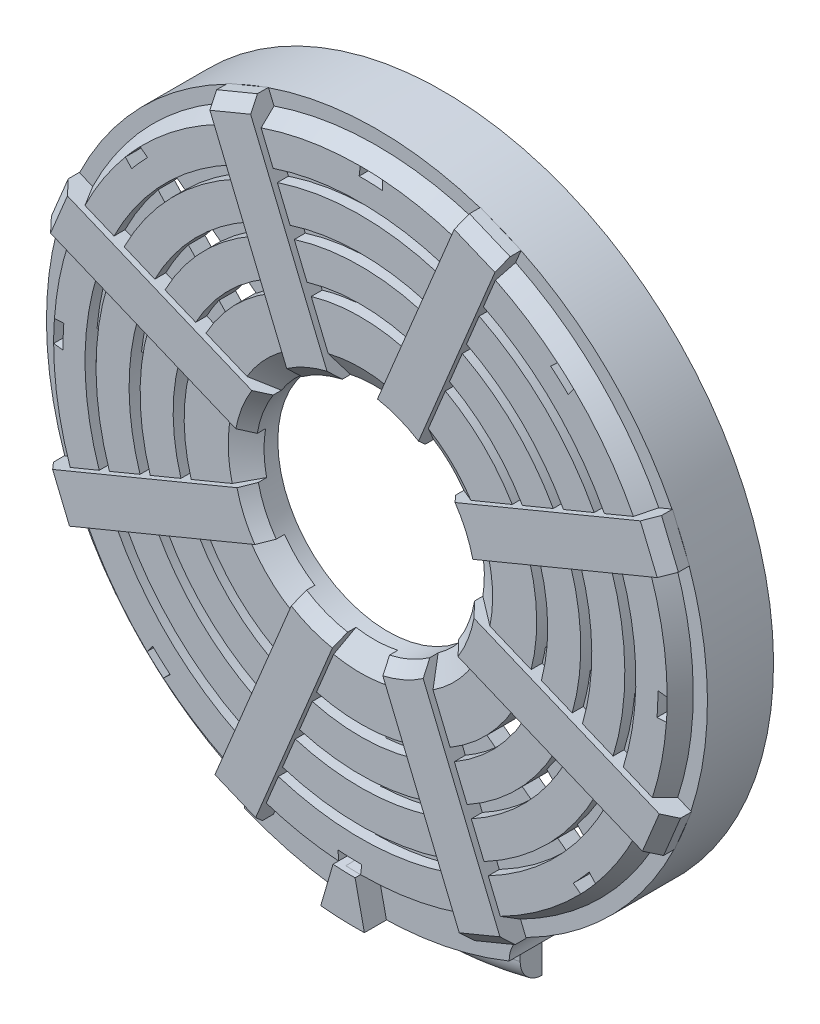
from build123d import *
from build123d.topology import SkipClean

# Parameters (mm, degrees)
SKETCH_2_R           = 26.935647111
EXTRUDE_1_DEPTH      = 2
CUT_EXTRUDE_START    = -2
CUT_EXTRUDE_3_DEPTH  = 2
CUT_EXTRUDE_4_DEPTH  = 2
FILLET_2_R           = 2
EXTRUDE_START        = -2
EXTRUDE_2_DEPTH      = 2
EXTRUDE_3_DEPTH      = 4
SKETCH_9_R           = 30
SKETCH_9_R_2         = 27
EXTRUDE_5_DEPTH      = 4
SKETCH_10_R          = 29
EXTRUDE_6_DEPTH      = 1.5
CHAMFER_1_SIZE       = 2
CHAMFER_1_SIZE_2     = 1.154700538
SKETCH_12_R          = 10
CUT_EXTRUDE_5_DEPTH  = 18
SKETCH_13_R          = 27
EXTRUDE_7_DEPTH      = 6
SKETCH_14_R          = 10
CUT_EXTRUDE_6_DEPTH  = 8
SKETCH_16_R          = 27
CUT_EXTRUDE_7_DEPTH  = 5
CHAMFER_2_SIZE       = 2
CHAMFER_2_SIZE2      = 1.249738704
SKETCH_17_R          = 25
SKETCH_17_R_2        = 24
SKETCH_17_R_3        = 21
SKETCH_17_R_4        = 20
SKETCH_17_R_5        = 17
SKETCH_17_R_6        = 16
CUT_EXTRUDE_10_DEPTH = 1
SKETCH_18_W          = 3
SKETCH_18_H          = 1
CUT_EXTRUDE_11_DEPTH = 71
SKETCH_25_R          = 10.8
SKETCH_25_R_2        = 10.020616019
EXTRUDE_18_DEPTH     = 1
EXTRUDE_19_DEPTH     = 1.5
CHAMFER_3_SIZE       = 2
CHAMFER_4_SIZE       = 2
CUT_EXTRUDE_13_DEPTH = 10
CUT_EXTRUDE_14_DEPTH = 10
EXTRUDE_20_DEPTH     = 3
SKETCH_34_R          = 44.888176971
CUT_EXTRUDE_15_DEPTH = 1


# Some blends are built 0.0001 mm under size
with BuildPart() as part:
    # 草图2 → 凸台-拉伸1 (new body)
    with BuildSketch(Plane.XY.offset(20)):
        with BuildLine():
            Line((12, -35.49545417), (12, -29.393876913))
            ThreePointArc((12, -29.393876913), (12.441591404, -27.82717801), (13.636363636, -26.721706285))
            ThreePointArc((13.636363636, -26.721706285), (0, 30), (-13.636363636, -26.721706285))
            ThreePointArc((-13.636363636, -26.721706285), (-12.441591404, -27.82717801), (-12, -29.393876913))
            Line((-12, -29.393876913), (-12, -35.49545417))
            ThreePointArc((-12, -35.49545417), (0, -37.469017424), (12, -35.49545417))
        make_face()
        Circle(SKETCH_2_R, mode=Mode.SUBTRACT)
    extrude(amount=EXTRUDE_1_DEPTH)

    # 草图3 → 切除-拉伸3 (cut)
    with BuildSketch(Plane.XY.offset(22).offset(CUT_EXTRUDE_START)):
        with BuildLine():
            Line((-9, -36.372067122), (-9, -28.618176043))
            ThreePointArc((-9, -28.618176043), (-11.357833819, -27.766879748), (-13.636363636, -26.721706285))
            ThreePointArc((-13.636363636, -26.721706285), (-12.441591404, -27.82717801), (-12, -29.393876913))
            Line((-12, -29.393876913), (-12, -35.49545417))
            ThreePointArc((-12, -35.49545417), (-10.509144236, -35.965054625), (-9, -36.372067122))
        make_face()
        with BuildLine():
            Line((9, -36.372067122), (9, -28.618176043))
            ThreePointArc((9, -28.618176043), (11.357833819, -27.766879748), (13.636363636, -26.721706285))
            ThreePointArc((13.636363636, -26.721706285), (12.441591404, -27.82717801), (12, -29.393876913))
            Line((12, -29.393876913), (12, -35.49545417))
            ThreePointArc((12, -35.49545417), (10.509144236, -35.965054625), (9, -36.372067122))
        make_face()
    extrude(amount=CUT_EXTRUDE_3_DEPTH, mode=Mode.SUBTRACT)

    # 草图4 → 切除-拉伸4 (cut)
    with BuildSketch(Plane.XY.offset(22).offset(CUT_EXTRUDE_START)):
        with BuildLine():
            Line((9, -35), (9, -36.372067122))
            ThreePointArc((9, -36.372067122), (0, -37.469017424), (-9, -36.372067122))
            Line((-9, -36.372067122), (-9, -35))
            ThreePointArc((-9, -35), (0, -36.138621999), (9, -35))
        make_face()
    extrude(amount=CUT_EXTRUDE_4_DEPTH, mode=Mode.SUBTRACT)

    # 圆角2
    fillet_2_edges = [part.edges().sort_by_distance(p)[0] for p in [
        (0, -36.138621999, 22),
    ]]
    fillet(fillet_2_edges, radius=FILLET_2_R - 0.0001)  # a hair under: the kernel refuses the full size

    # 草图7 → 凸台-拉伸2 (add)
    with BuildSketch(Plane.XY.offset(22).offset(EXTRUDE_START)):
        with BuildLine():
            Line((-9, -30.446674695), (-9, -28.618176043))
            ThreePointArc((-9, -28.618176043), (-11.357833819, -27.766879748), (-13.636363636, -26.721706285))
            ThreePointArc((-13.636363636, -26.721706285), (-12.441591404, -27.82717801), (-12, -29.393876913))
            ThreePointArc((-12, -29.393876913), (-10.513186757, -29.957852129), (-9, -30.446674695))
        make_face()
        with BuildLine():
            ThreePointArc((9, -28.618176043), (0, -30), (-9, -28.618176043))
            Line((-9, -28.618176043), (-9, -30.446674695))
            ThreePointArc((-9, -30.446674695), (0, -31.749015733), (9, -30.446674695))
            Line((9, -30.446674695), (9, -28.618176043))
        make_face()
        with BuildLine():
            ThreePointArc((13.636363636, -26.721706285), (11.357833819, -27.766879748), (9, -28.618176043))
            Line((9, -28.618176043), (9, -30.446674695))
            ThreePointArc((9, -30.446674695), (10.513186757, -29.957852129), (12, -29.393876913))
            ThreePointArc((12, -29.393876913), (12.441591404, -27.82717801), (13.636363636, -26.721706285))
        make_face()
    extrude(amount=EXTRUDE_2_DEPTH)

    # 草图8 → 凸台-拉伸3 (add)
    with BuildSketch(Plane.XY.offset(22)):
        with BuildLine():
            ThreePointArc((-12, -29.393876913), (0, -31.749015733), (12, -29.393876913))
            ThreePointArc((12, -29.393876913), (12.441591404, -27.82717801), (13.636363636, -26.721706285))
            ThreePointArc((13.636363636, -26.721706285), (0, -30), (-13.636363636, -26.721706285))
            ThreePointArc((-13.636363636, -26.721706285), (-12.441591404, -27.82717801), (-12, -29.393876913))
        make_face()
    extrude(amount=EXTRUDE_3_DEPTH)

    # 草图9 → 凸台-拉伸5 (add)
    with BuildSketch(Plane.XY.offset(22)):
        Circle(SKETCH_9_R)
        Circle(SKETCH_9_R_2, mode=Mode.SUBTRACT)
    extrude(amount=EXTRUDE_5_DEPTH)

    # 草图10 → 凸台-拉伸6 (add)
    with BuildSketch(Plane.XY.offset(26)):
        with Locations(Location((0, 0, 0), (0, 0, 180))):
            Circle(SKETCH_10_R)
    extrude(amount=EXTRUDE_6_DEPTH)

    # 倒角1
    # the kernel refuses this chamfer: 2, 1.154700538 mm, written as the material it takes off along each edge
    with BuildSketch(Plane(origin=(0, 0, 27.5), x_dir=(-1, 0, 0), z_dir=(0, 1, 0))) as chamfer_1_piece_1_section:
        Polygon((29, -CHAMFER_1_SIZE), (29 - CHAMFER_1_SIZE_2, 0), (29, 0), align=None)
    chamfer_1_piece_1 = revolve(axis=Axis((0, 0, 27.5), (0, 0, 1)), mode=Mode.PRIVATE)
    chamfer_1_piece_1 = split(chamfer_1_piece_1, bisect_by=Plane(origin=(28.310285577, 0, 26), z_dir=(0, 0, 1)), keep=Keep.TOP, mode=Mode.PRIVATE)
    add(chamfer_1_piece_1, mode=Mode.SUBTRACT)

    # 草图12 → 切除-拉伸5 (cut)
    with BuildSketch(Plane.XY.offset(27.5)):
        Circle(SKETCH_12_R)
    extrude(amount=-CUT_EXTRUDE_5_DEPTH, mode=Mode.SUBTRACT)

    # 草图13 → 凸台-拉伸7 (add)
    with BuildSketch(Plane(origin=(0, 0, 20), x_dir=(-1, 0, 0), z_dir=(0, 0, -1))):
        Circle(SKETCH_13_R)
    extrude(amount=-EXTRUDE_7_DEPTH)

    # 草图14 → 切除-拉伸6 (cut)
    with BuildSketch(Plane.XY.offset(27.5)):
        Circle(SKETCH_14_R)
    extrude(amount=-CUT_EXTRUDE_6_DEPTH, mode=Mode.SUBTRACT)

    # 草图16 → 切除-拉伸7 (cut)
    with BuildSketch(Plane(origin=(0, 0, 20), x_dir=(-1, 0, 0), z_dir=(0, 0, -1))):
        Circle(SKETCH_16_R)
    extrude(amount=-CUT_EXTRUDE_7_DEPTH, mode=Mode.SUBTRACT)

    # 倒角2
    chamfer_2_edges = [part.edges().sort_by_distance(p)[0] for p in [
        (-10, 0, 27.5),
    ]]
    chamfer_2_side = [part.faces().sort_by_distance(p)[0] for p in [
        (27.057715459, 0, 27.5),
    ]]
    chamfer(chamfer_2_edges, length=CHAMFER_2_SIZE, length2=CHAMFER_2_SIZE2, reference=chamfer_2_side[0])

    # 草图17 → 切除-拉伸10 (cut)
    # profile 1 of 3: a face of its own
    with BuildSketch(Plane.XY.offset(27.5)):
        Circle(SKETCH_17_R)
        Circle(SKETCH_17_R_2, mode=Mode.SUBTRACT)
    # profile 2 of 3: a face of its own
    with BuildSketch(Plane.XY.offset(27.5)):
        Circle(SKETCH_17_R_3)
        Circle(SKETCH_17_R_4, mode=Mode.SUBTRACT)
    # profile 3 of 3: a face of its own
    with BuildSketch(Plane.XY.offset(27.5)):
        Circle(SKETCH_17_R_5)
        Circle(SKETCH_17_R_6, mode=Mode.SUBTRACT)
    extrude(amount=-CUT_EXTRUDE_10_DEPTH, mode=Mode.SUBTRACT)

    # 草图18 → 切除-拉伸11 (cut)
    with BuildSketch(Plane(origin=(0, 0, 0), x_dir=(1, 0, 0), z_dir=(0, 1, 0))):
        with Locations((-9, -23.265514754)):
            Rectangle(SKETCH_18_W, SKETCH_18_H)
        with Locations((-3, -23.265514754)):
            Rectangle(SKETCH_18_W, SKETCH_18_H)
        with Locations((9, -23.265514754)):
            Rectangle(SKETCH_18_W, SKETCH_18_H)
        with Locations((3, -23.265514754)):
            Rectangle(SKETCH_18_W, SKETCH_18_H)
    extrude(amount=-CUT_EXTRUDE_11_DEPTH, mode=Mode.SUBTRACT)

    # 草图25 → 凸台-拉伸18 (add)
    with BuildSketch(Plane(origin=(0, 0, 25), x_dir=(-1, 0, 0), z_dir=(0, 0, -1))):
        Circle(SKETCH_25_R)
        Circle(SKETCH_25_R_2, mode=Mode.SUBTRACT)
    extrude(amount=-EXTRUDE_18_DEPTH)

    # 草图26 → 凸台-拉伸19 (add, symmetric)
    with SkipClean():  # the faces are left unmerged after this step: merging them gives an invalid solid
        with BuildSketch(Plane.XY.offset(27.5)):
            with BuildLine():
                ThreePointArc((-12.696537001, 24.782224482), (-10.883678655, 25.630182228), (-9.014595586, 26.345735301))
                Line((-9.014595586, 26.345735301), (-9.849943097, 28.362442592))
                Line((-9.849943097, 28.362442592), (-13.545461227, 26.831708862))
                Line((-13.545461227, 26.831708862), (-12.696537001, 24.782224482))
            make_face()
            with BuildLine():
                ThreePointArc((-5.804366846, 8.14305382), (-4.057894195, 9.139666006), (-2.147344545, 9.766724702))
                Line((-2.147344545, 9.766724702), (-7.923333429, 23.711195402))
                ThreePointArc((-7.923333429, 23.711195402), (-9.794923887, 23.001292704), (-11.603720064, 22.143931012))
                Line((-11.603720064, 22.143931012), (-5.804366846, 8.14305382))
            make_face()
            with BuildLine():
                ThreePointArc((-11.603720064, 22.143931012), (-9.794923887, 23.001292704), (-7.923333429, 23.711195402))
                Line((-7.923333429, 23.711195402), (-9.014595586, 26.345735301))
                ThreePointArc((-9.014595586, 26.345735301), (-10.883678655, 25.630182228), (-12.696537001, 24.782224482))
                Line((-12.696537001, 24.782224482), (-11.603720064, 22.143931012))
            make_face()
            with BuildLine():
                ThreePointArc((8.545871573, 26.501486395), (10.427352675, 25.819198638), (12.254966418, 25.003529755))
                Line((12.254966418, 25.003529755), (13.090313929, 27.020237046))
                Line((13.090313929, 27.020237046), (9.394795799, 28.550970775))
                Line((9.394795799, 28.550970775), (8.545871573, 26.501486395))
            make_face()
            with BuildLine():
                ThreePointArc((7.453054636, 23.863192925), (9.338312945, 23.190427149), (11.163704261, 22.368989856))
                Line((11.163704261, 22.368989856), (12.254966418, 25.003529755))
                ThreePointArc((12.254966418, 25.003529755), (10.427352675, 25.819198638), (8.545871573, 26.501486395))
                Line((8.545871573, 26.501486395), (7.453054636, 23.863192925))
            make_face()
            with BuildLine():
                ThreePointArc((1.653701418, 9.862315733), (3.593355308, 9.332084313), (5.387715377, 8.424519156))
                Line((5.387715377, 8.424519156), (11.163704261, 22.368989856))
                ThreePointArc((11.163704261, 22.368989856), (9.338312945, 23.190427149), (7.453054636, 23.863192925))
                Line((7.453054636, 23.863192925), (1.653701418, 9.862315733))
            make_face()
            with BuildLine():
                Line((22.143931012, 11.603720064), (8.14305382, 5.804366846))
                ThreePointArc((8.14305382, 5.804366846), (9.139666006, 4.057894195), (9.766724702, 2.147344545))
                Line((9.766724702, 2.147344545), (23.711195402, 7.923333429))
                ThreePointArc((23.711195402, 7.923333429), (23.001292704, 9.794923887), (22.143931012, 11.603720064))
            make_face()
            with BuildLine():
                Line((24.782224482, 12.696537001), (22.143931012, 11.603720064))
                ThreePointArc((22.143931012, 11.603720064), (23.001292704, 9.794923887), (23.711195402, 7.923333429))
                Line((23.711195402, 7.923333429), (26.345735301, 9.014595586))
                ThreePointArc((26.345735301, 9.014595586), (25.630182228, 10.883678655), (24.782224482, 12.696537001))
            make_face()
            with BuildLine():
                Line((26.831708862, 13.545461227), (24.782224482, 12.696537001))
                ThreePointArc((24.782224482, 12.696537001), (25.630182228, 10.883678655), (26.345735301, 9.014595586))
                Line((26.345735301, 9.014595586), (28.362442592, 9.849943097))
                Line((28.362442592, 9.849943097), (26.831708862, 13.545461227))
            make_face()
            with BuildLine():
                Line((26.501486395, -8.545871573), (23.863192925, -7.453054636))
                ThreePointArc((23.863192925, -7.453054636), (23.190427149, -9.338312945), (22.368989856, -11.163704261))
                Line((22.368989856, -11.163704261), (25.003529755, -12.254966418))
                ThreePointArc((25.003529755, -12.254966418), (25.819198638, -10.427352675), (26.501486395, -8.545871573))
            make_face()
            with BuildLine():
                Line((28.550970775, -9.394795799), (26.501486395, -8.545871573))
                ThreePointArc((26.501486395, -8.545871573), (25.819198638, -10.427352675), (25.003529755, -12.254966418))
                Line((25.003529755, -12.254966418), (27.020237046, -13.090313929))
                Line((27.020237046, -13.090313929), (28.550970775, -9.394795799))
            make_face()
            with BuildLine():
                Line((23.863192925, -7.453054636), (9.862315733, -1.653701418))
                ThreePointArc((9.862315733, -1.653701418), (9.332084313, -3.593355308), (8.424519156, -5.387715377))
                Line((8.424519156, -5.387715377), (22.368989856, -11.163704261))
                ThreePointArc((22.368989856, -11.163704261), (23.190427149, -9.338312945), (23.863192925, -7.453054636))
            make_face()
            with BuildLine():
                Line((11.603720064, -22.143931012), (5.804366846, -8.14305382))
                ThreePointArc((5.804366846, -8.14305382), (4.057894195, -9.139666006), (2.147344545, -9.766724702))
                Line((2.147344545, -9.766724702), (7.923333429, -23.711195402))
                ThreePointArc((7.923333429, -23.711195402), (9.794923887, -23.001292704), (11.603720064, -22.143931012))
            make_face()
            with BuildLine():
                Line((12.696537001, -24.782224482), (11.603720064, -22.143931012))
                ThreePointArc((11.603720064, -22.143931012), (9.794923887, -23.001292704), (7.923333429, -23.711195402))
                Line((7.923333429, -23.711195402), (9.014595586, -26.345735301))
                ThreePointArc((9.014595586, -26.345735301), (10.883678655, -25.630182228), (12.696537001, -24.782224482))
            make_face()
            with BuildLine():
                Line((13.545461227, -26.831708862), (12.696537001, -24.782224482))
                ThreePointArc((12.696537001, -24.782224482), (10.883678655, -25.630182228), (9.014595586, -26.345735301))
                Line((9.014595586, -26.345735301), (9.849943097, -28.362442592))
                Line((9.849943097, -28.362442592), (13.545461227, -26.831708862))
            make_face()
            with BuildLine():
                Line((-9.394795799, -28.550970775), (-8.545871573, -26.501486395))
                ThreePointArc((-8.545871573, -26.501486395), (-10.427352675, -25.819198638), (-12.254966418, -25.003529755))
                Line((-12.254966418, -25.003529755), (-13.090313929, -27.020237046))
                Line((-13.090313929, -27.020237046), (-9.394795799, -28.550970775))
            make_face()
            with BuildLine():
                Line((-7.453054636, -23.863192925), (-1.653701418, -9.862315733))
                ThreePointArc((-1.653701418, -9.862315733), (-3.593355308, -9.332084313), (-5.387715377, -8.424519156))
                Line((-5.387715377, -8.424519156), (-11.163704261, -22.368989856))
                ThreePointArc((-11.163704261, -22.368989856), (-9.338312945, -23.190427149), (-7.453054636, -23.863192925))
            make_face()
            with BuildLine():
                Line((-8.545871573, -26.501486395), (-7.453054636, -23.863192925))
                ThreePointArc((-7.453054636, -23.863192925), (-9.338312945, -23.190427149), (-11.163704261, -22.368989856))
                Line((-11.163704261, -22.368989856), (-12.254966418, -25.003529755))
                ThreePointArc((-12.254966418, -25.003529755), (-10.427352675, -25.819198638), (-8.545871573, -26.501486395))
            make_face()
            with BuildLine():
                ThreePointArc((-8.14305382, -5.804366846), (-9.139666006, -4.057894195), (-9.766724702, -2.147344545))
                Line((-9.766724702, -2.147344545), (-23.711195402, -7.923333429))
                ThreePointArc((-23.711195402, -7.923333429), (-23.001292704, -9.794923887), (-22.143931012, -11.603720064))
                Line((-22.143931012, -11.603720064), (-8.14305382, -5.804366846))
            make_face()
            with BuildLine():
                ThreePointArc((-22.143931012, -11.603720064), (-23.001292704, -9.794923887), (-23.711195402, -7.923333429))
                Line((-23.711195402, -7.923333429), (-26.345735301, -9.014595586))
                ThreePointArc((-26.345735301, -9.014595586), (-25.630182228, -10.883678655), (-24.782224482, -12.696537001))
                Line((-24.782224482, -12.696537001), (-22.143931012, -11.603720064))
            make_face()
            with BuildLine():
                ThreePointArc((-24.782224482, -12.696537001), (-25.630182228, -10.883678655), (-26.345735301, -9.014595586))
                Line((-26.345735301, -9.014595586), (-28.362442592, -9.849943097))
                Line((-28.362442592, -9.849943097), (-26.831708862, -13.545461227))
                Line((-26.831708862, -13.545461227), (-24.782224482, -12.696537001))
            make_face()
            with BuildLine():
                ThreePointArc((-9.862315733, 1.653701418), (-9.332084313, 3.593355308), (-8.424519156, 5.387715377))
                Line((-8.424519156, 5.387715377), (-22.368989856, 11.163704261))
                ThreePointArc((-22.368989856, 11.163704261), (-23.190427149, 9.338312945), (-23.863192925, 7.453054636))
                Line((-23.863192925, 7.453054636), (-9.862315733, 1.653701418))
            make_face()
            with BuildLine():
                ThreePointArc((-23.863192925, 7.453054636), (-23.190427149, 9.338312945), (-22.368989856, 11.163704261))
                Line((-22.368989856, 11.163704261), (-25.003529755, 12.254966418))
                ThreePointArc((-25.003529755, 12.254966418), (-25.819198638, 10.427352675), (-26.501486395, 8.545871573))
                Line((-26.501486395, 8.545871573), (-23.863192925, 7.453054636))
            make_face()
            with BuildLine():
                ThreePointArc((-26.501486395, 8.545871573), (-25.819198638, 10.427352675), (-25.003529755, 12.254966418))
                Line((-25.003529755, 12.254966418), (-27.020237046, 13.090313929))
                Line((-27.020237046, 13.090313929), (-28.550970775, 9.394795799))
                Line((-28.550970775, 9.394795799), (-26.501486395, 8.545871573))
            make_face()
        extrude(amount=EXTRUDE_19_DEPTH, both=True)

    # 倒角3
    chamfer_3_edges = [part.edges().sort_by_distance(p)[0] for p in [
        (-4.057894195, 9.139666006, 29),
        (3.593355308, 9.332084313, 29),
        (9.139666006, 4.057894195, 29),
        (9.332084313, -3.593355308, 29),
        (4.057894195, -9.139666006, 29),
        (-3.593355308, -9.332084313, 29),
        (-9.139666006, -4.057894195, 29),
        (-9.332084313, 3.593355308, 29),
    ]]
    chamfer(chamfer_3_edges, length=CHAMFER_3_SIZE)

    # 倒角4
    chamfer_4_edges = [part.edges().sort_by_distance(p)[0] for p in [
        (-11.697702162, 27.597075727, 29),
        (11.242554864, 27.785603911, 29),
        (27.597075727, 11.697702162, 29),
        (27.785603911, -11.242554864, 29),
        (11.697702162, -27.597075727, 29),
        (-11.242554864, -27.785603911, 29),
        (-27.597075727, -11.697702162, 29),
        (-27.785603911, 11.242554864, 29),
    ]]
    chamfer(chamfer_4_edges, length=CHAMFER_4_SIZE)

    # 草图30 → 切除-拉伸13 (cut)
    with BuildSketch(Plane.XY.offset(27.5)):
        with BuildLine():
            Line((-2.126135419, -24.909426894), (-2.175382477, -23.901207314))
            ThreePointArc((-2.175382477, -23.901207314), (-0.849786937, -23.984950743), (0.478411395, -23.995231246))
            Line((0.478411395, -23.995231246), (0.357934938, -24.99743752))
            ThreePointArc((0.357934938, -24.99743752), (-0.885194726, -24.984323691), (-2.126135419, -24.909426894))
        make_face()
        with BuildLine():
            Line((-12.843867709, -16.614302943), (-12.104365365, -15.92119151))
            ThreePointArc((-12.104365365, -15.92119151), (-13.390169765, -14.856088101), (-14.582653444, -13.68744748))
            Line((-14.582653444, -13.68744748), (-15.195490387, -14.494725658))
            ThreePointArc((-15.195490387, -14.494725658), (-14.059678253, -15.598892506), (-12.843867709, -16.614302943))
        make_face()
        with BuildLine():
            Line((2.126135419, 24.909426894), (2.175382477, 23.901207314))
            ThreePointArc((2.175382477, 23.901207314), (0.849786937, 23.984950743), (-0.478411395, 23.995231246))
            Line((-0.478411395, 23.995231246), (-0.357934938, 24.99743752))
            ThreePointArc((-0.357934938, 24.99743752), (0.885194726, 24.984323691), (2.126135419, 24.909426894))
        make_face()
        with BuildLine():
            Line((-2.56527052, -15.919151584), (-2.571480969, -15.792007017))
            ThreePointArc((-2.571480969, -15.792007017), (-0.566524625, -15.989967162), (1.447414317, -15.934396499))
            Line((1.447414317, -15.934396499), (1.432221271, -16.06078274))
            Line((1.432221271, -16.06078274), (1.32553855, -16.9482432))
            ThreePointArc((1.32553855, -16.9482432), (-0.601932414, -16.98934011), (-2.521661916, -16.811936866))
            Line((-2.521661916, -16.811936866), (-2.56527052, -15.919151584))
        make_face()
        with BuildLine():
            Line((-1.986195559, -27.774371808), (-2.027744721, -26.923748835))
            ThreePointArc((-2.027744721, -26.923748835), (-0.956010304, -26.983069586), (0.11723502, -26.999745479))
            Line((0.11723502, -26.999745479), (0.015590454, -27.845295097))
            ThreePointArc((0.015590454, -27.845295097), (-0.985940489, -27.827839001), (-1.986195559, -27.774371808))
        make_face()
        with BuildLine():
            Line((-12.738209811, -11.257797779), (-12.197744622, -10.545853504))
            Line((-12.197744622, -10.545853504), (-12.120775149, -10.444463116))
            ThreePointArc((-12.120775149, -10.444463116), (-10.712135812, -11.884870481), (-9.133648943, -13.136835882))
            Line((-9.133648943, -13.136835882), (-9.226527002, -13.223887457))
            Line((-9.226527002, -13.223887457), (-9.878699294, -13.83514728))
            ThreePointArc((-9.878699294, -13.83514728), (-11.3816443, -12.627674886), (-12.738209811, -11.257797779))
        make_face()
        with BuildLine():
            Line((0.840494588, -20.983173469), (0.961462809, -19.976876364))
            ThreePointArc((0.961462809, -19.976876364), (-0.708155781, -19.987458953), (-2.372838988, -19.858742033))
            Line((-2.372838988, -19.858742033), (-2.323390913, -20.871076989))
            ThreePointArc((-2.323390913, -20.871076989), (-0.74356357, -20.9868319), (0.840494588, -20.983173469))
        make_face()
        with BuildLine():
            Line((-19.374536136, -19.999701289), (-18.859594733, -19.321379001))
            ThreePointArc((-18.859594733, -19.321379001), (-18.076729183, -20.055718937), (-17.265294623, -20.758362208))
            Line((-17.265294623, -20.758362208), (-17.886667696, -21.340754927))
            ThreePointArc((-17.886667696, -21.340754927), (-18.642664347, -20.6836111), (-19.374536136, -19.999701289))
        make_face()
        with BuildLine():
            Line((-17.640185195, -17.715074549), (-17.029839576, -16.911078144))
            ThreePointArc((-17.029839576, -16.911078144), (-16.068203718, -17.827305721), (-15.057352946, -18.688930474))
            Line((-15.057352946, -18.688930474), (-15.793849042, -19.379224248))
            ThreePointArc((-15.793849042, -19.379224248), (-16.737712206, -18.570110126), (-17.640185195, -17.715074549))
        make_face()
        with BuildLine():
            Line((2.56527052, 15.919151584), (2.571480969, 15.792007017))
            ThreePointArc((2.571480969, 15.792007017), (0.566524625, 15.989967162), (-1.447414317, 15.934396499))
            Line((-1.447414317, 15.934396499), (-1.432221271, 16.06078274))
            Line((-1.432221271, 16.06078274), (-1.32553855, 16.9482432))
            ThreePointArc((-1.32553855, 16.9482432), (0.601932414, 16.98934011), (2.521661916, 16.811936866))
            Line((2.521661916, 16.811936866), (2.56527052, 15.919151584))
        make_face()
        with BuildLine():
            Line((1.986195559, 27.774371808), (2.027744721, 26.923748835))
            ThreePointArc((2.027744721, 26.923748835), (0.956010304, 26.983069586), (-0.11723502, 26.999745479))
            Line((-0.11723502, 26.999745479), (-0.015590454, 27.845295097))
            ThreePointArc((-0.015590454, 27.845295097), (0.985940489, 27.827839001), (1.986195559, 27.774371808))
        make_face()
        with BuildLine():
            Line((12.843867709, 16.614302943), (12.104365365, 15.92119151))
            ThreePointArc((12.104365365, 15.92119151), (13.390169765, 14.856088101), (14.582653444, 13.68744748))
            Line((14.582653444, 13.68744748), (15.195490387, 14.494725658))
            ThreePointArc((15.195490387, 14.494725658), (14.059678253, 15.598892506), (12.843867709, 16.614302943))
        make_face()
        with BuildLine():
            Line((12.738209811, 11.257797779), (12.197744622, 10.545853504))
            Line((12.197744622, 10.545853504), (12.120775149, 10.444463116))
            ThreePointArc((12.120775149, 10.444463116), (10.712135812, 11.884870481), (9.133648943, 13.136835882))
            Line((9.133648943, 13.136835882), (9.226527002, 13.223887457))
            Line((9.226527002, 13.223887457), (9.878699294, 13.83514728))
            ThreePointArc((9.878699294, 13.83514728), (11.3816443, 12.627674886), (12.738209811, 11.257797779))
        make_face()
        with BuildLine():
            Line((19.374536136, 19.999701289), (18.859594733, 19.321379001))
            ThreePointArc((18.859594733, 19.321379001), (18.076729183, 20.055718937), (17.265294623, 20.758362208))
            Line((17.265294623, 20.758362208), (17.886667696, 21.340754927))
            ThreePointArc((17.886667696, 21.340754927), (18.642664347, 20.6836111), (19.374536136, 19.999701289))
        make_face()
        with BuildLine():
            Line((-0.840494588, 20.983173469), (-0.961462809, 19.976876364))
            ThreePointArc((-0.961462809, 19.976876364), (0.708155781, 19.987458953), (2.372838988, 19.858742033))
            Line((2.372838988, 19.858742033), (2.323390913, 20.871076989))
            ThreePointArc((2.323390913, 20.871076989), (0.74356357, 20.9868319), (-0.840494588, 20.983173469))
        make_face()
        with BuildLine():
            Line((17.640185195, 17.715074549), (17.029839576, 16.911078144))
            ThreePointArc((17.029839576, 16.911078144), (16.068203718, 17.827305721), (15.057352946, 18.688930474))
            Line((15.057352946, 18.688930474), (15.793849042, 19.379224248))
            ThreePointArc((15.793849042, 19.379224248), (16.737712206, 18.570110126), (17.640185195, 17.715074549))
        make_face()
    extrude(amount=-CUT_EXTRUDE_13_DEPTH, mode=Mode.SUBTRACT)

    # 草图31 → 切除-拉伸14 (cut)
    with BuildSketch(Plane.XY.offset(27.5)):
        with BuildLine():
            Line((19.32146818, -18.85950337), (19.999703135, -19.37453423))
            ThreePointArc((19.999703135, -19.37453423), (20.6836111, -18.642664347), (21.340753222, -17.886669729))
            Line((21.340753222, -17.886669729), (20.758280568, -17.265392781))
            ThreePointArc((20.758280568, -17.265392781), (20.055718937, -18.076729183), (19.32146818, -18.85950337))
        make_face()
        with BuildLine():
            Line((15.898543824, -2.564540387), (16.812179047, -2.520046764))
            ThreePointArc((16.812179047, -2.520046764), (16.98934011, -0.601932414), (16.948370467, 1.323910308))
            Line((16.948370467, 1.323910308), (16.04017498, 1.432951404))
            Line((16.04017498, 1.432951404), (15.934558287, 1.445632109))
            ThreePointArc((15.934558287, 1.445632109), (15.989967162, -0.566524625), (15.792294528, -2.56971468))
            Line((15.792294528, -2.56971468), (15.898543824, -2.564540387))
        make_face()
        with BuildLine():
            Line((19.858881229, -2.371673742), (20.871190083, -2.322374758))
            ThreePointArc((20.871190083, -2.322374758), (20.9868319, -0.74356357), (20.983214366, 0.839472977))
            Line((20.983214366, 0.839472977), (19.976932745, 0.960290633))
            ThreePointArc((19.976932745, 0.960290633), (19.987458953, -0.708155781), (19.858881229, -2.371673742))
        make_face()
        with BuildLine():
            Line((23.995242663, 0.477838429), (24.997443591, 0.357510715))
            ThreePointArc((24.997443591, 0.357510715), (24.984323691, -0.885194726), (24.909462972, -2.12571269))
            Line((24.909462972, -2.12571269), (23.901259252, -2.174811756))
            ThreePointArc((23.901259252, -2.174811756), (23.984950743, -0.849786937), (23.995242663, 0.477838429))
        make_face()
        with BuildLine():
            Line((18.688570924, -15.057799202), (19.378956213, -15.794177918))
            ThreePointArc((19.378956213, -15.794177918), (18.570110126, -16.737712206), (17.715373912, -17.639884556))
            Line((17.715373912, -17.639884556), (16.911484783, -17.029435764))
            ThreePointArc((16.911484783, -17.029435764), (17.827305721, -16.068203718), (18.688570924, -15.057799202))
        make_face()
        with BuildLine():
            Line((26.923758423, -2.02761741), (27.774371997, -1.986192913))
            ThreePointArc((27.774371997, -1.986192913), (27.827839001, -0.985940489), (27.845295099, 0.015587801))
            Line((27.845295099, 0.015587801), (26.999746033, 0.117107349))
            ThreePointArc((26.999746033, 0.117107349), (26.983069586, -0.956010304), (26.923758423, -2.02761741))
        make_face()
        with BuildLine():
            Line((13.688303116, -14.581850287), (14.495465465, -15.194784663))
            ThreePointArc((14.495465465, -15.194784663), (15.598892506, -14.059678253), (16.613677592, -12.844676597))
            Line((16.613677592, -12.844676597), (15.920481241, -12.105299545))
            ThreePointArc((15.920481241, -12.105299545), (14.856088101, -13.390169765), (13.688303116, -14.581850287))
        make_face()
        with BuildLine():
            Line((10.530536365, -12.183938895), (10.445818711, -12.119606902))
            ThreePointArc((10.445818711, -12.119606902), (11.884870481, -10.712135812), (13.135814238, -9.135118188))
            Line((13.135814238, -9.135118188), (13.208570318, -9.212721274))
            Line((13.208570318, -9.212721274), (13.834198159, -9.880028406))
            ThreePointArc((13.834198159, -9.880028406), (12.627674886, -11.3816443), (11.2590215, -12.737128203))
            Line((11.2590215, -12.737128203), (10.530536365, -12.183938895))
        make_face()
        with BuildLine():
            Line((-15.898543824, 2.564540387), (-16.812179047, 2.520046764))
            ThreePointArc((-16.812179047, 2.520046764), (-16.98934011, 0.601932414), (-16.948370467, -1.323910308))
            Line((-16.948370467, -1.323910308), (-16.04017498, -1.432951404))
            Line((-16.04017498, -1.432951404), (-15.934558287, -1.445632109))
            ThreePointArc((-15.934558287, -1.445632109), (-15.989967162, 0.566524625), (-15.792294528, 2.56971468))
            Line((-15.792294528, 2.56971468), (-15.898543824, 2.564540387))
        make_face()
        with BuildLine():
            Line((-19.858881229, 2.371673742), (-20.871190083, 2.322374758))
            ThreePointArc((-20.871190083, 2.322374758), (-20.9868319, 0.74356357), (-20.983214366, -0.839472977))
            Line((-20.983214366, -0.839472977), (-19.976932745, -0.960290633))
            ThreePointArc((-19.976932745, -0.960290633), (-19.987458953, 0.708155781), (-19.858881229, 2.371673742))
        make_face()
        with BuildLine():
            Line((-23.995242663, -0.477838429), (-24.997443591, -0.357510715))
            ThreePointArc((-24.997443591, -0.357510715), (-24.984323691, 0.885194726), (-24.909462972, 2.12571269))
            Line((-24.909462972, 2.12571269), (-23.901259252, 2.174811756))
            ThreePointArc((-23.901259252, 2.174811756), (-23.984950743, 0.849786937), (-23.995242663, -0.477838429))
        make_face()
        with BuildLine():
            Line((-26.923758423, 2.02761741), (-27.774371997, 1.986192913))
            ThreePointArc((-27.774371997, 1.986192913), (-27.827839001, 0.985940489), (-27.845295099, -0.015587801))
            Line((-27.845295099, -0.015587801), (-26.999746033, -0.117107349))
            ThreePointArc((-26.999746033, -0.117107349), (-26.983069586, 0.956010304), (-26.923758423, 2.02761741))
        make_face()
        with BuildLine():
            Line((-19.32146818, 18.85950337), (-19.999703135, 19.37453423))
            ThreePointArc((-19.999703135, 19.37453423), (-20.6836111, 18.642664347), (-21.340753222, 17.886669729))
            Line((-21.340753222, 17.886669729), (-20.758280568, 17.265392781))
            ThreePointArc((-20.758280568, 17.265392781), (-20.055718937, 18.076729183), (-19.32146818, 18.85950337))
        make_face()
        with BuildLine():
            Line((-18.688570924, 15.057799202), (-19.378956213, 15.794177918))
            ThreePointArc((-19.378956213, 15.794177918), (-18.570110126, 16.737712206), (-17.715373912, 17.639884556))
            Line((-17.715373912, 17.639884556), (-16.911484783, 17.029435764))
            ThreePointArc((-16.911484783, 17.029435764), (-17.827305721, 16.068203718), (-18.688570924, 15.057799202))
        make_face()
        with BuildLine():
            Line((-13.688303116, 14.581850287), (-14.495465465, 15.194784663))
            ThreePointArc((-14.495465465, 15.194784663), (-15.598892506, 14.059678253), (-16.613677592, 12.844676597))
            Line((-16.613677592, 12.844676597), (-15.920481241, 12.105299545))
            ThreePointArc((-15.920481241, 12.105299545), (-14.856088101, 13.390169765), (-13.688303116, 14.581850287))
        make_face()
        with BuildLine():
            Line((-10.530536365, 12.183938895), (-10.445818711, 12.119606902))
            ThreePointArc((-10.445818711, 12.119606902), (-11.884870481, 10.712135812), (-13.135814238, 9.135118188))
            Line((-13.135814238, 9.135118188), (-13.208570318, 9.212721274))
            Line((-13.208570318, 9.212721274), (-13.834198159, 9.880028406))
            ThreePointArc((-13.834198159, 9.880028406), (-12.627674886, 11.3816443), (-11.2590215, 12.737128203))
            Line((-11.2590215, 12.737128203), (-10.530536365, 12.183938895))
        make_face()
    extrude(amount=-CUT_EXTRUDE_14_DEPTH, mode=Mode.SUBTRACT)


with BuildPart() as body_2:
    # 草图32 → 凸台-拉伸20 (new body)
    with BuildSketch(Plane.XY.offset(26)):
        with BuildLine():
            Line((-1.986195559, -27.774371808), (-3.104919331, -31.596826992))
            ThreePointArc((-3.104919331, -31.596826992), (-1.124162452, -31.729107438), (0.860989474, -31.737339163))
            Line((0.860989474, -31.737339163), (0.015590454, -27.845295097))
            ThreePointArc((0.015590454, -27.845295097), (-0.985940489, -27.827839001), (-1.986195559, -27.774371808))
        make_face()
    extrude(amount=EXTRUDE_20_DEPTH)


with BuildPart() as cut_extrude_15_tool:
    # 草图34 → 切除-拉伸15 (new body)
    with BuildSketch(Plane.XY.offset(29)):
        Circle(SKETCH_34_R)
    extrude(amount=-CUT_EXTRUDE_15_DEPTH)


with BuildPart() as part_1:
    add(part.part)

    # 切除-拉伸15: cut by cut_extrude_15_tool
    add(cut_extrude_15_tool.part, mode=Mode.SUBTRACT)


with BuildPart() as body_2_1:
    add(body_2.part)

    # 切除-拉伸15: cut by cut_extrude_15_tool
    add(cut_extrude_15_tool.part, mode=Mode.SUBTRACT)


solid = Compound([part_1.part, body_2_1.part])
